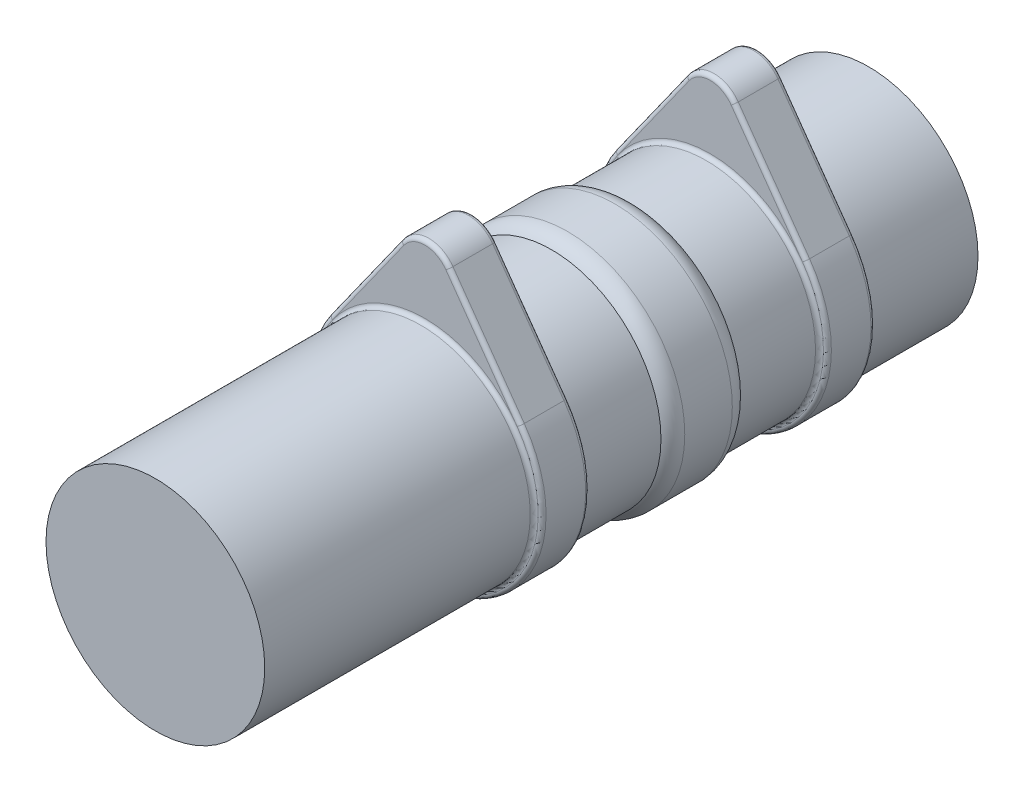
from build123d import *

# Parameters (mm, degrees)
SKETCH1_R           = 13.8
BOSS_EXTRUDE1_DEPTH = 34
BOSS_EXTRUDE2_DEPTH = 6
SKETCH4_R           = 13.8
BOSS_EXTRUDE3_DEPTH = 10
SKETCH5_R           = 14.8
BOSS_EXTRUDE4_DEPTH = 10
SKETCH6_R           = 13.8
BOSS_EXTRUDE5_DEPTH = 10
FILLET1_R           = 2.5
BOSS_EXTRUDE6_DEPTH = 6
FILLET2_R           = 0.5
SKETCH8_R           = 13.8
BOSS_EXTRUDE8_DEPTH = 14


# Some blends are built 0.0001 mm under size
with BuildPart() as part:
    # Sketch1 → Boss-Extrude1 (new body)
    with BuildSketch(Plane.XY):
        Circle(SKETCH1_R)
    extrude(amount=-BOSS_EXTRUDE1_DEPTH)

    # Sketch3 → Boss-Extrude2 (add)
    with BuildSketch(Plane(origin=(0, 0, -34), x_dir=(-1, 0, 0), z_dir=(0, 0, -1))):
        with BuildLine():
            Line((-3.054671613, 21.22519685), (-12.055770632, 8.584776903))
            ThreePointArc((-12.055770632, 8.584776903), (0, -14.8), (12.055770632, 8.584776903))
            Line((12.055770632, 8.584776903), (3.054671613, 21.22519685))
            ThreePointArc((3.054671613, 21.22519685), (0, 22.8), (-3.054671613, 21.22519685))
        make_face()
    extrude(amount=BOSS_EXTRUDE2_DEPTH)

    # Sketch4 → Boss-Extrude3 (add)
    with BuildSketch(Plane(origin=(0, 0, -40), x_dir=(-1, 0, 0), z_dir=(0, 0, -1))):
        with Locations(Location((0, 0, 0), (0, 0, 180))):
            Circle(SKETCH4_R)
    extrude(amount=BOSS_EXTRUDE3_DEPTH)

    # Sketch5 → Boss-Extrude4 (add)
    with BuildSketch(Plane(origin=(0, 0, -50), x_dir=(-1, 0, 0), z_dir=(0, 0, -1))):
        Circle(SKETCH5_R)
    extrude(amount=BOSS_EXTRUDE4_DEPTH)

    # Sketch6 → Boss-Extrude5 (add)
    with BuildSketch(Plane(origin=(0, 0, -60), x_dir=(-1, 0, 0), z_dir=(0, 0, -1))):
        with Locations(Location((0, 0, 0), (0, 0, 180))):
            Circle(SKETCH6_R)
    extrude(amount=BOSS_EXTRUDE5_DEPTH)

    # Fillet1
    # the kernel refuses this fillet: 2.5 mm, written as the material it takes off along each edge
    with BuildSketch(Plane(origin=(0, 0, -50), x_dir=(-1, 0, 0), z_dir=(0, -1, 0))) as fillet1_piece_1:
        with BuildLine():
            CenterArc((12.3, 2), FILLET1_R, 306.869897646, 53.130102354)
            Line((13.8, 0), (13.83, -0.04))
            ThreePointArc((13.83, -0.04), (14.3, -0.05), (14.8, -0.05))
            Line((14.8, -0.05), (14.85, 0))
            Line((14.85, 0), (14.85, 2))
            Line((14.85, 2), (14.8, 2))
        make_face()
    revolve(axis=Axis((0, 0, -50), (0, 0, -1)), mode=Mode.SUBTRACT)
    with BuildSketch(Plane(origin=(0, 0, -60), x_dir=(-1, 0, 0), z_dir=(0, -1, 0))) as fillet1_piece_2:
        with BuildLine():
            CenterArc((12.3, -2), FILLET1_R, 0, 53.130102354)
            Line((13.8, 0), (13.83, 0.04))
            ThreePointArc((13.83, 0.04), (14.3, 0.05), (14.8, 0.05))
            Line((14.8, 0.05), (14.85, 0))
            Line((14.85, 0), (14.85, -2))
            Line((14.85, -2), (14.8, -2))
        make_face()
    revolve(axis=Axis((0, 0, -60), (0, 0, -1)), mode=Mode.SUBTRACT)

    # Sketch7 → Boss-Extrude6 (add)
    with BuildSketch(Plane(origin=(0, 0, -70), x_dir=(-1, 0, 0), z_dir=(0, 0, -1))):
        with BuildLine():
            Line((-3.054671613, 21.22519685), (-12.055770632, 8.584776903))
            ThreePointArc((-12.055770632, 8.584776903), (0, -14.8), (12.055770632, 8.584776903))
            Line((12.055770632, 8.584776903), (3.054671613, 21.22519685))
            ThreePointArc((3.054671613, 21.22519685), (0, 22.8), (-3.054671613, 21.22519685))
        make_face()
    extrude(amount=BOSS_EXTRUDE6_DEPTH)

    # Fillet2
    fillet2_edges = [part.edges().sort_by_distance(p)[0] for p in [
        (-13.8, 0, -40),
        (-13.8, 0, -70),
        (0, 22.8, -70),
        (7.555221122, 14.904986877, -70),
        (0, -14.8, -70),
        (-7.555221122, 14.904986877, -70),
        (0, 22.8, -76),
        (7.555221122, 14.904986877, -76),
        (0, -14.8, -76),
        (-7.555221122, 14.904986877, -76),
        (-13.8, 0, -34),
        (0, 22.8, -34),
        (7.555221122, 14.904986877, -34),
        (0, -14.8, -34),
        (-7.555221122, 14.904986877, -34),
        (0, 22.8, -40),
        (7.555221122, 14.904986877, -40),
        (0, -14.8, -40),
        (-7.555221122, 14.904986877, -40),
    ]]
    fillet(fillet2_edges, radius=FILLET2_R - 0.0001)  # a hair under: the kernel refuses the full size

    # Sketch8 → Boss-Extrude8 (add)
    with BuildSketch(Plane(origin=(0, 0, -76), x_dir=(-1, 0, 0), z_dir=(0, 0, -1))):
        with Locations(Location((0, 0, 0), (0, 0, 180))):
            Circle(SKETCH8_R)
    extrude(amount=BOSS_EXTRUDE8_DEPTH)


solid = part.part
